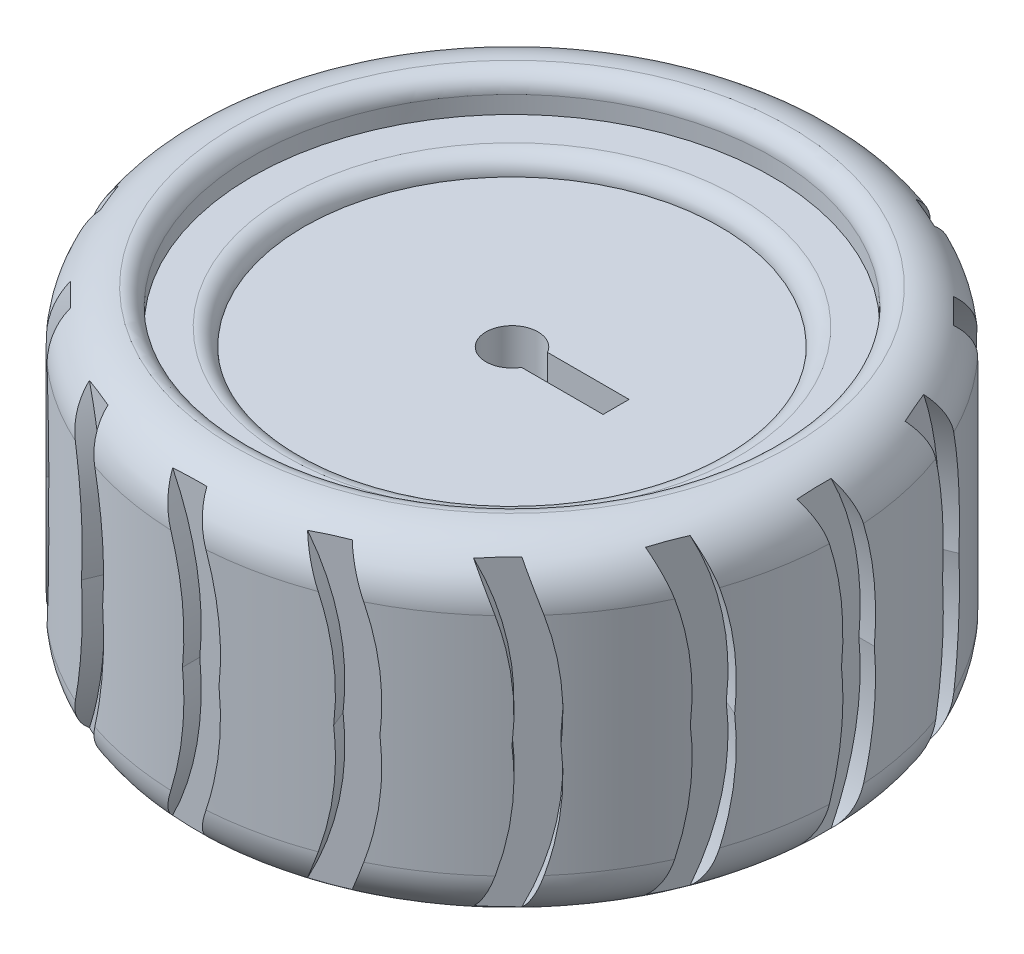
from build123d import *

# Parameters (mm, degrees)
CUT_EXTRUDE_1_DEPTH      = 26.416530054
CUT_EXTRUDE_1_DEPTH_BACK = 26.416530054
CUT_EXTRUDE_2_DEPTH      = 5
SKETCH_4_W               = 4
SKETCH_4_H               = 19
FILLET_1_R               = 1
FILLET_2_R               = 3
CUT_EXTRUDE_7_DEPTH      = 7
PATTERN_CIRCULAR_3_COUNT = 16


with BuildPart() as part:
    # 草图1 → 旋转1 (revolve)
    with BuildSketch(Plane.XY):
        with BuildLine():
            Line((13, -7.5), (15, -7.5))
            Line((15, -7.5), (15, 7.5))
            Line((15, 7.5), (12, 7.5))
            Line((12, 7.5), (12, 6.5))
            Line((12, 6.5), (0, 6.5))
            Line((0, 6.5), (0, -2.5))
            ThreePointArc((0, -2.5), (6, -4.438476164), (12, -2.5))
            Line((12, -2.5), (13, -2.5))
            Line((13, -2.5), (13, -7.5))
        make_face()
    revolve(axis=Axis((0, -2.5, 0), (0, 1, 0)))

    # 草图2 → 切除-拉伸1 (cut, two sides: drawn at the far end of the back side and taken through both)
    with BuildSketch(Plane(origin=(0, 6.5, 0), x_dir=(1, 0, 0), z_dir=(0, 1, 0)).offset(-CUT_EXTRUDE_1_DEPTH_BACK)):
        with BuildLine():
            Line((1.299038106, -0.75), (6, -0.75))
            Line((6, -0.75), (6, 0.75))
            Line((6, 0.75), (1.299038106, 0.75))
            ThreePointArc((1.299038106, 0.75), (-1.5, 0), (1.299038106, -0.75))
        make_face()
    extrude(amount=CUT_EXTRUDE_1_DEPTH + CUT_EXTRUDE_1_DEPTH_BACK, mode=Mode.SUBTRACT)

    # 草图3 → 切除-拉伸2 (cut)
    with BuildSketch(Plane.XZ.offset(7.5)):
        with BuildLine():
            Line((12.978347352, -0.75), (14.981238267, -0.75))
            ThreePointArc((14.981238267, -0.75), (15, 0), (14.981238267, 0.75))
            Line((14.981238267, 0.75), (12.978347352, 0.75))
            ThreePointArc((12.978347352, 0.75), (13, 0), (12.978347352, -0.75))
        make_face()
        with BuildLine():
            Line((12.780706914, -2.377715455), (14.725397458, -2.857038625))
            ThreePointArc((14.725397458, -2.857038625), (14.564127261, -3.589734964), (14.366423962, -4.313451351))
            Line((14.366423962, -4.313451351), (12.421733417, -3.834128181))
            ThreePointArc((12.421733417, -3.834128181), (12.622243627, -3.111103636), (12.780706914, -2.377715455))
        make_face()
        with BuildLine():
            Line((11.840298245, -5.36724673), (13.613770074, -6.298036549))
            ThreePointArc((13.613770074, -6.298036549), (13.281840385, -6.970847581), (12.916685316, -7.626220588))
            Line((12.916685316, -7.626220588), (11.143213487, -6.695430769))
            ThreePointArc((11.143213487, -6.695430769), (11.510928333, -6.041401237), (11.840298245, -5.36724673))
        make_face()
        with BuildLine():
            Line((10.21177448, -8.044853135), (11.710959857, -9.373015482))
            ThreePointArc((11.710959857, -9.373015482), (11.227661223, -9.946839874), (10.71627587, -10.495781604))
            Line((10.71627587, -10.495781604), (9.217090493, -9.167619257))
            ThreePointArc((9.217090493, -9.167619257), (9.730639726, -8.620594557), (10.21177448, -8.044853135))
        make_face()
        with BuildLine():
            Line((7.989779501, -10.254921917), (9.127551221, -11.903268824))
            ThreePointArc((9.127551221, -11.903268824), (8.520971201, -12.344757988), (7.893075422, -12.755365945))
            Line((7.893075422, -12.755365945), (6.755303702, -11.107019037))
            ThreePointArc((6.755303702, -11.107019037), (7.384841708, -10.698790257), (7.989779501, -10.254921917))
        make_face()
        with BuildLine():
            Line((5.303447579, -11.869011912), (6.013682485, -13.74174745))
            ThreePointArc((6.013682485, -13.74174745), (5.319073306, -14.02524364), (4.611158121, -14.27365478))
            Line((4.611158121, -14.27365478), (3.900923215, -12.400919243))
            ThreePointArc((3.900923215, -12.400919243), (4.609863532, -12.155211155), (5.303447579, -11.869011912))
        make_face()
        with BuildLine():
            Line((2.308898561, -12.793318078), (2.550320382, -14.781605662))
            ThreePointArc((2.550320382, -14.781605662), (1.808050204, -14.890633111), (1.061257071, -14.962410682))
            Line((1.061257071, -14.962410682), (0.819835249, -12.974123098))
            ThreePointArc((0.819835249, -12.974123098), (1.566976843, -12.905215363), (2.308898561, -12.793318078))
        make_face()
        with BuildLine():
            Line((-0.819835249, -12.974123098), (-1.061257071, -14.962410682))
            ThreePointArc((-1.061257071, -14.962410682), (-1.808050204, -14.890633111), (-2.550320382, -14.781605662))
            Line((-2.550320382, -14.781605662), (-2.308898561, -12.793318078))
            ThreePointArc((-2.308898561, -12.793318078), (-1.566976843, -12.905215363), (-0.819835249, -12.974123098))
        make_face()
        with BuildLine():
            Line((-3.900923215, -12.400919243), (-4.611158121, -14.27365478))
            ThreePointArc((-4.611158121, -14.27365478), (-5.319073306, -14.02524364), (-6.013682485, -13.74174745))
            Line((-6.013682485, -13.74174745), (-5.303447579, -11.869011912))
            ThreePointArc((-5.303447579, -11.869011912), (-4.609863532, -12.155211155), (-3.900923215, -12.400919243))
        make_face()
        with BuildLine():
            Line((-6.755303702, -11.107019037), (-7.893075422, -12.755365945))
            ThreePointArc((-7.893075422, -12.755365945), (-8.520971201, -12.344757988), (-9.127551221, -11.903268824))
            Line((-9.127551221, -11.903268824), (-7.989779501, -10.254921917))
            ThreePointArc((-7.989779501, -10.254921917), (-7.384841708, -10.698790257), (-6.755303702, -11.107019037))
        make_face()
        with BuildLine():
            Line((-9.217090493, -9.167619257), (-10.71627587, -10.495781604))
            ThreePointArc((-10.71627587, -10.495781604), (-11.227661223, -9.946839874), (-11.710959857, -9.373015482))
            Line((-11.710959857, -9.373015482), (-10.21177448, -8.044853135))
            ThreePointArc((-10.21177448, -8.044853135), (-9.730639726, -8.620594557), (-9.217090493, -9.167619257))
        make_face()
        with BuildLine():
            Line((-11.143213487, -6.695430769), (-12.916685316, -7.626220588))
            ThreePointArc((-12.916685316, -7.626220588), (-13.281840385, -6.970847581), (-13.613770074, -6.298036549))
            Line((-13.613770074, -6.298036549), (-11.840298245, -5.36724673))
            ThreePointArc((-11.840298245, -5.36724673), (-11.510928333, -6.041401237), (-11.143213487, -6.695430769))
        make_face()
        with BuildLine():
            Line((-12.421733417, -3.834128181), (-14.366423962, -4.313451351))
            ThreePointArc((-14.366423962, -4.313451351), (-14.564127261, -3.589734964), (-14.725397458, -2.857038625))
            Line((-14.725397458, -2.857038625), (-12.780706914, -2.377715455))
            ThreePointArc((-12.780706914, -2.377715455), (-12.622243627, -3.111103636), (-12.421733417, -3.834128181))
        make_face()
        with BuildLine():
            Line((-12.978347352, -0.75), (-14.981238267, -0.75))
            ThreePointArc((-14.981238267, -0.75), (-15, 0), (-14.981238267, 0.75))
            Line((-14.981238267, 0.75), (-12.978347352, 0.75))
            ThreePointArc((-12.978347352, 0.75), (-13, 0), (-12.978347352, -0.75))
        make_face()
        with BuildLine():
            Line((-12.780706914, 2.377715455), (-14.725397458, 2.857038625))
            ThreePointArc((-14.725397458, 2.857038625), (-14.564127261, 3.589734964), (-14.366423962, 4.313451351))
            Line((-14.366423962, 4.313451351), (-12.421733417, 3.834128181))
            ThreePointArc((-12.421733417, 3.834128181), (-12.622243627, 3.111103636), (-12.780706914, 2.377715455))
        make_face()
        with BuildLine():
            Line((-11.840298245, 5.36724673), (-13.613770074, 6.298036549))
            ThreePointArc((-13.613770074, 6.298036549), (-13.281840385, 6.970847581), (-12.916685316, 7.626220588))
            Line((-12.916685316, 7.626220588), (-11.143213487, 6.695430769))
            ThreePointArc((-11.143213487, 6.695430769), (-11.510928333, 6.041401237), (-11.840298245, 5.36724673))
        make_face()
        with BuildLine():
            Line((-10.21177448, 8.044853135), (-11.710959857, 9.373015482))
            ThreePointArc((-11.710959857, 9.373015482), (-11.227661223, 9.946839874), (-10.71627587, 10.495781604))
            Line((-10.71627587, 10.495781604), (-9.217090493, 9.167619257))
            ThreePointArc((-9.217090493, 9.167619257), (-9.730639726, 8.620594557), (-10.21177448, 8.044853135))
        make_face()
        with BuildLine():
            Line((-7.989779501, 10.254921917), (-9.127551221, 11.903268824))
            ThreePointArc((-9.127551221, 11.903268824), (-8.520971201, 12.344757988), (-7.893075422, 12.755365945))
            Line((-7.893075422, 12.755365945), (-6.755303702, 11.107019037))
            ThreePointArc((-6.755303702, 11.107019037), (-7.384841708, 10.698790257), (-7.989779501, 10.254921917))
        make_face()
        with BuildLine():
            Line((-5.303447579, 11.869011912), (-6.013682485, 13.74174745))
            ThreePointArc((-6.013682485, 13.74174745), (-5.319073306, 14.02524364), (-4.611158121, 14.27365478))
            Line((-4.611158121, 14.27365478), (-3.900923215, 12.400919243))
            ThreePointArc((-3.900923215, 12.400919243), (-4.609863532, 12.155211155), (-5.303447579, 11.869011912))
        make_face()
        with BuildLine():
            Line((-2.308898561, 12.793318078), (-2.550320382, 14.781605662))
            ThreePointArc((-2.550320382, 14.781605662), (-1.808050204, 14.890633111), (-1.061257071, 14.962410682))
            Line((-1.061257071, 14.962410682), (-0.819835249, 12.974123098))
            ThreePointArc((-0.819835249, 12.974123098), (-1.566976843, 12.905215363), (-2.308898561, 12.793318078))
        make_face()
        with BuildLine():
            Line((0.819835249, 12.974123098), (1.061257071, 14.962410682))
            ThreePointArc((1.061257071, 14.962410682), (1.808050204, 14.890633111), (2.550320382, 14.781605662))
            Line((2.550320382, 14.781605662), (2.308898561, 12.793318078))
            ThreePointArc((2.308898561, 12.793318078), (1.566976843, 12.905215363), (0.819835249, 12.974123098))
        make_face()
        with BuildLine():
            Line((3.900923215, 12.400919243), (4.611158121, 14.27365478))
            ThreePointArc((4.611158121, 14.27365478), (5.319073306, 14.02524364), (6.013682485, 13.74174745))
            Line((6.013682485, 13.74174745), (5.303447579, 11.869011912))
            ThreePointArc((5.303447579, 11.869011912), (4.609863532, 12.155211155), (3.900923215, 12.400919243))
        make_face()
        with BuildLine():
            Line((6.755303702, 11.107019037), (7.893075422, 12.755365945))
            ThreePointArc((7.893075422, 12.755365945), (8.520971201, 12.344757988), (9.127551221, 11.903268824))
            Line((9.127551221, 11.903268824), (7.989779501, 10.254921917))
            ThreePointArc((7.989779501, 10.254921917), (7.384841708, 10.698790257), (6.755303702, 11.107019037))
        make_face()
        with BuildLine():
            Line((9.217090493, 9.167619257), (10.71627587, 10.495781604))
            ThreePointArc((10.71627587, 10.495781604), (11.227661223, 9.946839874), (11.710959857, 9.373015482))
            Line((11.710959857, 9.373015482), (10.21177448, 8.044853135))
            ThreePointArc((10.21177448, 8.044853135), (9.730639726, 8.620594557), (9.217090493, 9.167619257))
        make_face()
        with BuildLine():
            Line((11.143213487, 6.695430769), (12.916685316, 7.626220588))
            ThreePointArc((12.916685316, 7.626220588), (13.281840385, 6.970847581), (13.613770074, 6.298036549))
            Line((13.613770074, 6.298036549), (11.840298245, 5.36724673))
            ThreePointArc((11.840298245, 5.36724673), (11.510928333, 6.041401237), (11.143213487, 6.695430769))
        make_face()
        with BuildLine():
            Line((12.421733417, 3.834128181), (14.366423962, 4.313451351))
            ThreePointArc((14.366423962, 4.313451351), (14.564127261, 3.589734964), (14.725397458, 2.857038625))
            Line((14.725397458, 2.857038625), (12.780706914, 2.377715455))
            ThreePointArc((12.780706914, 2.377715455), (12.622243627, 3.111103636), (12.421733417, 3.834128181))
        make_face()
    extrude(amount=-CUT_EXTRUDE_2_DEPTH, mode=Mode.SUBTRACT)

    # 草图4 → 旋转2 (revolve)
    with BuildSketch(Plane.XY, mode=Mode.PRIVATE) as revolve_2_sk:
        with Locations((17, 0)):
            Rectangle(SKETCH_4_W, SKETCH_4_H)
    revolve(revolve_2_sk.sketch.rotate(Axis((0, -1000, 0), (0, 1, 0)), 90), axis=Axis((0, -1000, 0), (0, 1, 0)))

    # 圆角1
    fillet_1_edges = [part.edges().sort_by_distance(p)[0] for p in [
        (0, -9.5, 15),
        (0, 9.5, 15),
        (-12, 7.5, 0),
    ]]
    fillet(fillet_1_edges, radius=FILLET_1_R - 0.0001)  # a hair under: the kernel refuses the full size

    # 圆角2
    fillet_2_edges = [part.edges().sort_by_distance(p)[0] for p in [
        (0, 9.5, 19),
        (0, -9.5, 19),
    ]]
    fillet(fillet_2_edges, radius=FILLET_2_R)

    # 草图6 → 切除-拉伸7 (cut)
    with BuildSketch(Plane.XY.offset(-25)):
        with BuildLine():
            Line((0, 9.5), (2, 9.5))
            ThreePointArc((2, 9.5), (0.26359749, 4.905032107), (0, 0))
            ThreePointArc((0, 0), (0.26359749, -4.905032107), (2, -9.5))
            Line((2, -9.5), (0, -9.5))
            ThreePointArc((0, -9.5), (-1.73141336, -4.90398176), (-2, 0))
            ThreePointArc((-2, 0), (-1.73141336, 4.90398176), (0, 9.5))
        make_face()
    cut_extrude_7 = extrude(amount=CUT_EXTRUDE_7_DEPTH, mode=Mode.SUBTRACT)

    # 阵列(圆周)3: 切除-拉伸7 ×16 about axis
    pattern_circular_3_axis = Axis((0, 0, 0), (0, 1, 0))
    for i in range(1, PATTERN_CIRCULAR_3_COUNT):
        add(cut_extrude_7.rotate(pattern_circular_3_axis, i * 360 / PATTERN_CIRCULAR_3_COUNT), mode=Mode.SUBTRACT)


solid = part.part
